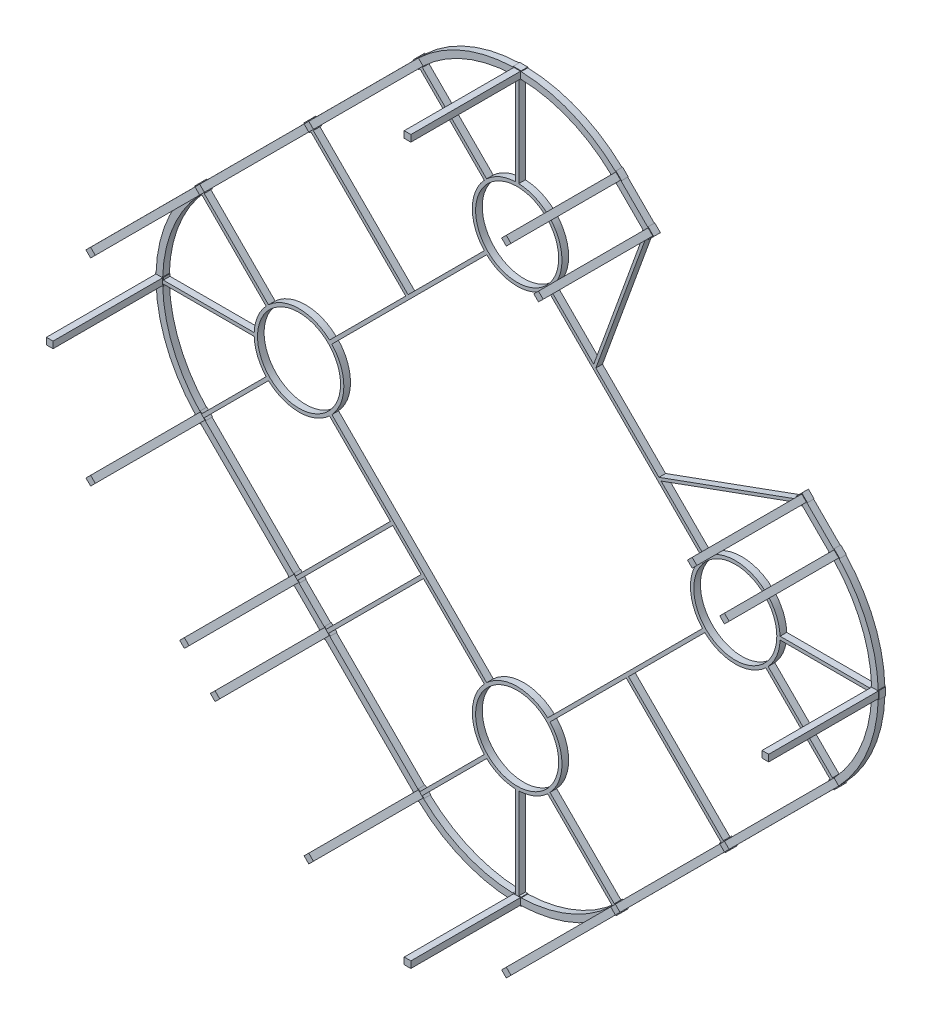
from build123d import *

# Parameters (mm, degrees)
SKETCH1_W           = 2
SKETCH1_H           = 2
SKETCH1_R           = 12.5
BOSS_EXTRUDE1_DEPTH = 2
BOSS_EXTRUDE2_START = 33
SKETCH1_4_W         = 2
SKETCH1_4_H         = 2
BOSS_EXTRUDE2_DEPTH = 35


with BuildPart() as part:
    # Sketch1 → Boss-Extrude1 (new body)
    with BuildSketch(Plane.XY):
        with BuildLine():
            Line((-31.435123313, 95.412267808), (-31.294942546, 95.272087041))
            Line((-31.294942546, 95.272087041), (-62.43499077, 64.132038826))
            Line((-62.43499077, 64.132038826), (-62.571728993, 64.268777048))
            ThreePointArc((-62.571728993, 64.268777048), (-63.424888478, 63.424880259), (-64.268785267, 62.571720774))
            Line((-64.268785267, 62.571720774), (-64.132047045, 62.434982551))
            Line((-64.132047045, 62.434982551), (-95.277376251, 31.289653354))
            Line((-95.277376251, 31.289653354), (-95.416507662, 31.428775598))
            ThreePointArc((-95.416507662, 31.428775598), (-96.269639345, 30.584850702), (-97.113508027, 29.731663416))
            Line((-97.113508027, 29.731663416), (-96.962451883, 29.580617225))
            ThreePointArc((-96.962451883, 29.580617225), (-105.455698333, 16.473999941), (-108.715081354, 1.2))
            Line((-108.715081354, 1.2), (-108.925171911, 1.2))
            ThreePointArc((-108.925171911, 1.2), (-108.931721626, 0), (-108.925171911, -1.2))
            Line((-108.925171911, -1.2), (-108.715081354, -1.2))
            ThreePointArc((-108.715081354, -1.2), (-105.454208222, -16.477597845), (-96.95710069, -29.586276386))
            Line((-96.95710069, -29.586276386), (-97.11252837, -29.741704066))
            ThreePointArc((-97.11252837, -29.741704066), (-96.268631581, -30.594863551), (-95.415472097, -31.43876034))
            Line((-95.415472097, -31.43876034), (-95.271870681, -31.295158925))
            Line((-95.271870681, -31.295158925), (-68.75163623, -57.815393377))
            Line((-68.75163623, -57.815393377), (-68.883691414, -57.947448561))
            ThreePointArc((-68.883691414, -57.947448561), (-68.039794625, -58.800608046), (-67.18663514, -59.644504836))
            Line((-67.18663514, -59.644504836), (-67.054579955, -59.512449651))
            Line((-67.054579955, -59.512449651), (-59.512441432, -67.054588174))
            Line((-59.512441432, -67.054588174), (-59.644496617, -67.186643359))
            ThreePointArc((-59.644496617, -67.186643359), (-58.800599827, -68.039802844), (-57.947440342, -68.883699633))
            Line((-57.947440342, -68.883699633), (-57.815385158, -68.751644449))
            Line((-57.815385158, -68.751644449), (-31.289437098, -95.277592509))
            Line((-31.289437098, -95.277592509), (-31.431979886, -95.420144689))
            ThreePointArc((-31.431979886, -95.420144689), (-30.58805499, -96.273276372), (-29.734867704, -97.117145054))
            Line((-29.734867704, -97.117145054), (-29.580394899, -96.962662071))
            ThreePointArc((-29.580394899, -96.962662071), (-16.473858603, -105.455756861), (-1.2, -108.715081354))
            Line((-1.2, -108.715081354), (-1.2, -108.925171911))
            ThreePointArc((-1.2, -108.925171911), (0, -108.931721626), (1.2, -108.925171911))
            Line((1.2, -108.925171911), (1.2, -108.715081354))
            ThreePointArc((1.2, -108.715081354), (16.475362295, -105.455134144), (29.582760167, -96.960425786))
            Line((29.582760167, -96.960425786), (29.738499779, -97.116165398))
            ThreePointArc((29.738499779, -97.116165398), (30.591659251, -96.272268621), (31.435556028, -95.419109149))
            Line((31.435556028, -95.419109149), (31.291738242, -95.275291363))
            Line((31.291738242, -95.275291363), (62.434990775, -64.13203883))
            Line((62.434990775, -64.13203883), (62.571728993, -64.268777048))
            ThreePointArc((62.571728993, -64.268777048), (63.424888478, -63.424880259), (64.268785267, -62.571720774))
            Line((64.268785267, -62.571720774), (64.13204705, -62.434982556))
            Line((64.13204705, -62.434982556), (95.274171844, -31.292857762))
            Line((95.274171844, -31.292857762), (95.416940402, -31.435616913))
            ThreePointArc((95.416940402, -31.435616913), (96.270072085, -30.591692018), (97.113940767, -29.738504732))
            Line((97.113940767, -29.738504732), (96.959337229, -29.58391138))
            ThreePointArc((96.959337229, -29.58391138), (105.454831021, -16.476094196), (108.715081354, -1.2))
            Line((108.715081354, -1.2), (108.925171911, -1.2))
            ThreePointArc((108.925171911, -1.2), (108.931721626, 0), (108.925171911, 1.2))
            Line((108.925171911, 1.2), (108.715081354, 1.2))
            ThreePointArc((108.715081354, 1.2), (105.455192708, 16.475220886), (96.960636099, 29.58253774))
            Line((96.960636099, 29.58253774), (97.11296111, 29.734862751))
            ThreePointArc((97.11296111, 29.734862751), (96.269064321, 30.588022236), (95.415904836, 31.431919026))
            Line((95.415904836, 31.431919026), (95.275507708, 31.291521898))
            Line((95.275507708, 31.291521898), (87.267374473, 39.299655132))
            Line((87.267374473, 39.299655132), (87.391886748, 39.424175611))
            ThreePointArc((87.391886748, 39.424175611), (86.547961853, 40.277307294), (85.694774566, 41.121175976))
            Line((85.694774566, 41.121175976), (83.997730649, 39.424020239))
            Line((83.997730649, 39.424020239), (84.523348399, 38.90501768))
            Line((84.523348399, 38.90501768), (42.688694475, 23.692180335))
            Line((42.688694475, 23.692180335), (23.692180335, 42.688694476))
            Line((23.692180335, 42.688694476), (38.90501768, 84.523348399))
            ThreePointArc((38.90501768, 84.523348399), (39.165408576, 84.259818217), (39.42489, 83.995392488))
            Line((39.42489, 83.995392488), (41.121989828, 85.692492316))
            ThreePointArc((41.121989828, 85.692492316), (40.278093039, 86.545651802), (39.424933554, 87.389548591))
            Line((39.424933554, 87.389548591), (39.301207283, 87.26582232))
            Line((39.301207283, 87.26582232), (31.29307402, 95.273955586))
            Line((31.29307402, 95.273955586), (31.432412626, 95.413303374))
            ThreePointArc((31.432412626, 95.413303374), (30.588487731, 96.266435057), (29.735300444, 97.110303739))
            Line((29.735300444, 97.110303739), (29.584133682, 96.959127017))
            ThreePointArc((29.584133682, 96.959127017), (16.47623553, 105.454772485), (1.2, 108.715081354))
            Line((1.2, 108.715081354), (1.2, 108.925171911))
            ThreePointArc((1.2, 108.925171911), (0, 108.931721626), (-1.2, 108.925171911))
            Line((-1.2, 108.925171911), (-1.2, 108.715081354))
            ThreePointArc((-1.2, 108.715081354), (-16.477456439, 105.454266794), (-29.586053982, 96.957311026))
            Line((-29.586053982, 96.957311026), (-29.738067039, 97.109324083))
            ThreePointArc((-29.738067039, 97.109324083), (-30.591226524, 96.265427293), (-31.435123313, 95.412267808))
        make_face()
        Polygon((-57.948849643, -65.773839097), (-56.534636081, -67.188052659), (-57.948849644, -68.602266222), (-59.363063205, -67.18805266), align=None, mode=Mode.SUBTRACT)
        Polygon((-68.602258003, -57.948857862), (-67.18804444, -56.5346443), (-65.773830878, -57.948857862), (-67.188044441, -59.363071424), align=None, mode=Mode.SUBTRACT)
        with BuildLine():
            Line((-1, -108.720192419), (-1, -106.727164964))
            Line((-1, -106.727164964), (1, -106.727164964))
            Line((1, -106.727164964), (1, -108.720192419))
            ThreePointArc((1, -108.720192419), (0, -108.731806219), (-1, -108.720192419))
        make_face(mode=Mode.SUBTRACT)
        with BuildLine():
            ThreePointArc((-0.5, -106.530643766), (-0.850004503, -106.528446659), (-1.2, -106.525110317))
            Line((-1.2, -106.525110317), (-1.2, -106.71426632))
            ThreePointArc((-1.2, -106.71426632), (-15.708522052, -103.607985233), (-28.165645199, -95.547819152))
            Line((-28.165645199, -95.547819152), (-28.037823786, -95.419989317))
            ThreePointArc((-28.037823786, -95.419989317), (-28.290532968, -95.17205965), (-28.542424536, -94.923299346))
            Line((-28.542424536, -94.923299346), (-9.185838624, -75.566713434))
            ThreePointArc((-9.185838624, -75.566713434), (-5.166226337, -78.146141718), (-0.5, -79.164505592))
            Line((-0.5, -79.164505592), (-0.5, -106.530643766))
        make_face(mode=Mode.SUBTRACT)
        with BuildLine():
            Line((-9.892945405, -74.859606653), (-29.249501876, -94.216163124))
            ThreePointArc((-29.249501876, -94.216163124), (-29.49261564, -93.96996653), (-29.734935968, -93.722988952))
            Line((-29.734935968, -93.722988952), (-29.875270126, -93.863332356))
            Line((-29.875270126, -93.863332356), (-56.401171595, -67.337430886))
            Line((-56.401171595, -67.337430886), (-56.250340514, -67.186599805))
            ThreePointArc((-56.250340514, -67.186599805), (-56.500190067, -66.94146865), (-56.749240385, -66.695525526))
            Line((-56.749240385, -66.695525526), (-28.217294835, -38.163579976))
            Line((-28.217294835, -38.163579976), (-9.892945405, -56.487929406))
            ThreePointArc((-9.892945405, -56.487929406), (-13.5, -65.673768029), (-9.892945405, -74.859606653))
        make_face(mode=Mode.SUBTRACT)
        Polygon((-96.824253644, -29.736272052), (-95.410040081, -28.32205849), (-93.99588073, -29.736326262), (-95.410094292, -31.150539824), align=None, mode=Mode.SUBTRACT)
        with BuildLine():
            Line((-93.857657118, -29.880945363), (-93.718372267, -29.741660512))
            ThreePointArc((-93.718372267, -29.741660512), (-93.968265881, -29.496485989), (-94.217359977, -29.250499209))
            Line((-94.217359977, -29.250499209), (-74.859710109, -9.892849343))
            ThreePointArc((-74.859710109, -9.892849343), (-65.673838618, -13.5), (-56.487929406, -9.892945405))
            Line((-56.487929406, -9.892945405), (-38.163579976, -28.217294835))
            Line((-38.163579976, -28.217294835), (-66.695525488, -56.749240347))
            ThreePointArc((-66.695525488, -56.749240347), (-66.941464508, -56.500194144), (-67.186591586, -56.250348733))
            Line((-67.186591586, -56.250348733), (-67.337422681, -56.401179828))
            Line((-67.337422681, -56.401179828), (-93.857657118, -29.880945363))
        make_face(mode=Mode.SUBTRACT)
        with BuildLine():
            Line((-106.71426632, -1.2), (-106.525110317, -1.2))
            ThreePointArc((-106.525110317, -1.2), (-106.528446659, -0.850004502), (-106.530643766, -0.499999998))
            Line((-106.530643766, -0.499999998), (-79.164505593, -0.5))
            ThreePointArc((-79.164505593, -0.5), (-78.146141718, -5.166226337), (-75.566713434, -9.185838624))
            Line((-75.566713434, -9.185838624), (-94.924581431, -28.543274818))
            ThreePointArc((-94.924581431, -28.543274818), (-95.170410598, -28.294338776), (-95.415428542, -28.044604238))
            Line((-95.415428542, -28.044604238), (-95.542310811, -28.171486507))
            ThreePointArc((-95.542310811, -28.171486507), (-103.606449157, -15.71223098), (-106.71426632, -1.2))
        make_face(mode=Mode.SUBTRACT)
        with Locations((-107.727164964, 0)):
            Rectangle(SKETCH1_W, SKETCH1_H, mode=Mode.SUBTRACT)
        with BuildLine():
            Line((-37.456473194, -28.924401616), (-28.924401616, -37.456473194))
            Line((-28.924401616, -37.456473194), (-57.456347052, -65.98841863))
            ThreePointArc((-57.456347052, -65.98841863), (-57.702277865, -65.739380657), (-57.947396788, -65.48954353))
            Line((-57.947396788, -65.48954353), (-58.09822787, -65.640374612))
            Line((-58.09822787, -65.640374612), (-65.640366392, -58.098236089))
            Line((-65.640366392, -58.098236089), (-65.489535311, -57.947405007))
            ThreePointArc((-65.489535311, -57.947405007), (-65.73937658, -57.702282007), (-65.988418669, -57.45634709))
            Line((-65.988418669, -57.45634709), (-37.456473194, -28.924401616))
        make_face(mode=Mode.SUBTRACT)
        with BuildLine():
            Line((1.2, -106.71426632), (1.2, -106.525110317))
            ThreePointArc((1.2, -106.525110317), (0.850004503, -106.528446659), (0.5, -106.530643766))
            Line((0.5, -106.530643766), (0.5, -79.164505592))
            ThreePointArc((0.5, -79.164505592), (5.166226337, -78.146141718), (9.185838623, -75.566713434))
            Line((9.185838623, -75.566713434), (28.543507024, -94.924813642))
            ThreePointArc((28.543507024, -94.924813642), (28.292858284, -95.172350836), (28.04139995, -95.41906557))
            Line((28.04139995, -95.41906557), (28.16796563, -95.545631249))
            ThreePointArc((28.16796563, -95.545631249), (15.709995342, -103.607375112), (1.2, -106.71426632))
        make_face(mode=Mode.SUBTRACT)
        Polygon((28.318854202, -95.413677109), (29.733122848, -93.999518631), (31.14733641, -95.413732193), (29.733067765, -96.827890671), align=None, mode=Mode.SUBTRACT)
        with Locations((0, -65.673768029)):
            Circle(SKETCH1_R, mode=Mode.SUBTRACT)
        with BuildLine():
            ThreePointArc((61.373512521, -62.080619303), (61.124470433, -62.326554219), (60.874629164, -62.57167722))
            Line((60.874629164, -62.57167722), (61.020777213, -62.717825268))
            Line((61.020777213, -62.717825268), (29.87752468, -93.861077801))
            Line((29.87752468, -93.861077801), (29.738456199, -93.72200932))
            ThreePointArc((29.738456199, -93.72200932), (29.494978432, -93.970179101), (29.250699576, -94.217560393))
            Line((29.250699576, -94.217560393), (9.892849342, -74.859710109))
            ThreePointArc((9.892849342, -74.859710109), (13.5, -65.673838618), (9.892945405, -56.487929406))
            Line((9.892945405, -56.487929406), (32.836884015, -33.543990796))
            Line((32.836884015, -33.543990796), (61.373512521, -62.080619303))
        make_face(mode=Mode.SUBTRACT)
        Polygon((61.162198569, -62.576403912), (62.576412131, -61.16219035), (63.987351856, -62.573130075), (62.573138294, -63.987343637), align=None, mode=Mode.SUBTRACT)
        with BuildLine():
            Line((62.717833487, -61.020768994), (62.571685439, -60.874620945))
            ThreePointArc((62.571685439, -60.874620945), (62.326558361, -61.124466356), (62.080619341, -61.37351256))
            Line((62.080619341, -61.37351256), (33.543990796, -32.836884015))
            Line((33.543990796, -32.836884015), (56.487929406, -9.892945405))
            ThreePointArc((56.487929406, -9.892945405), (65.673768029, -13.5), (74.859606653, -9.892945405))
            Line((74.859606653, -9.892945405), (94.216395465, -29.249734217))
            ThreePointArc((94.216395465, -29.249734217), (93.968486044, -29.494555882), (93.719784664, -29.738572996))
            Line((93.719784664, -29.738572996), (93.859911691, -29.87869079))
            Line((93.859911691, -29.87869079), (62.717833487, -61.020768994))
        make_face(mode=Mode.SUBTRACT)
        Polygon((95.411553103, -31.147396575), (93.997293824, -29.733230477), (95.411405709, -28.318915243), (96.825665861, -29.733082215), align=None, mode=Mode.SUBTRACT)
        with BuildLine():
            Line((95.544498976, -28.169166346), (95.416785029, -28.041460814))
            ThreePointArc((95.416785029, -28.041460814), (95.170552124, -28.29244617), (94.923499876, -28.542625065))
            Line((94.923499876, -28.542625065), (75.566713434, -9.185838623))
            ThreePointArc((75.566713434, -9.185838623), (78.146141718, -5.166226337), (79.164505592, -0.5))
            Line((79.164505592, -0.5), (106.530643766, -0.5))
            ThreePointArc((106.530643766, -0.5), (106.528446659, -0.850004503), (106.525110317, -1.2))
            Line((106.525110317, -1.2), (106.71426632, -1.2))
            ThreePointArc((106.71426632, -1.2), (103.607059362, -15.710757734), (95.544498976, -28.169166346))
        make_face(mode=Mode.SUBTRACT)
        with BuildLine():
            ThreePointArc((-106.530643766, 0.500000002), (-106.528446659, 0.850004504), (-106.525110317, 1.2))
            Line((-106.525110317, 1.2), (-106.71426632, 1.2))
            ThreePointArc((-106.71426632, 1.2), (-103.607926703, 15.708663396), (-95.547609259, 28.165867821))
            Line((-95.547609259, 28.165867821), (-95.416352289, 28.034619499))
            ThreePointArc((-95.416352289, 28.034619499), (-95.168529951, 28.287219642), (-94.919877692, 28.53900288))
            Line((-94.919877692, 28.53900288), (-75.566713434, 9.185838624))
            ThreePointArc((-75.566713434, 9.185838624), (-78.146141718, 5.166226337), (-79.164505593, 0.5))
            Line((-79.164505593, 0.5), (-106.530643766, 0.500000002))
        make_face(mode=Mode.SUBTRACT)
        with Locations((-65.673768029, 0)):
            Circle(SKETCH1_R, mode=Mode.SUBTRACT)
        with BuildLine():
            Line((-93.996861084, 29.726389161), (-95.410972969, 28.312073928))
            Line((-95.410972969, 28.312073928), (-96.824670308, 29.725678123))
            ThreePointArc((-96.824670308, 29.725678123), (-96.474644043, 30.088215127), (-96.120398817, 30.446630788))
            Line((-96.120398817, 30.446630788), (-95.411120363, 31.140555259))
            Line((-95.411120363, 31.140555259), (-93.996861084, 29.726389161))
        make_face(mode=Mode.SUBTRACT)
        with BuildLine():
            Line((-62.717833482, 61.020768989), (-62.571685439, 60.874620945))
            ThreePointArc((-62.571685439, 60.874620945), (-62.326558361, 61.124466356), (-62.080619341, 61.37351256))
            Line((-62.080619341, 61.37351256), (-33.543990796, 32.836884015))
            Line((-33.543990796, 32.836884015), (-56.487929406, 9.892945405))
            ThreePointArc((-56.487929406, 9.892945405), (-65.673768029, 13.5), (-74.859606653, 9.892945405))
            Line((-74.859606653, 9.892945405), (-94.212743482, 29.246082232))
            ThreePointArc((-94.212743482, 29.246082232), (-93.966438542, 29.489304024), (-93.719351925, 29.73173168))
            Line((-93.719351925, 29.73173168), (-93.863116099, 29.875486382))
            Line((-93.863116099, 29.875486382), (-62.717833482, 61.020768989))
        make_face(mode=Mode.SUBTRACT)
        with BuildLine():
            Line((-55.780822625, 9.185838624), (-9.185838624, 55.780822625))
            ThreePointArc((-9.185838624, 55.780822625), (5.4698e-05, 52.173768029), (9.18591879, 55.780897062))
            Line((9.18591879, 55.780897062), (55.780844249, 9.185861913))
            ThreePointArc((55.780844249, 9.185861913), (52.173768029, 1.589e-05), (55.780822624, -9.185838624))
            Line((55.780822624, -9.185838624), (9.185838623, -55.780822625))
            ThreePointArc((9.185838623, -55.780822625), (-5.4698e-05, -52.173768029), (-9.18591879, -55.780897062))
            Line((-9.18591879, -55.780897062), (-55.780844249, -9.185861913))
            ThreePointArc((-55.780844249, -9.185861913), (-52.173768029, -1.589e-05), (-55.780822625, 9.185838624))
        make_face(mode=Mode.SUBTRACT)
        Polygon((-62.57313829, 63.987343631), (-61.162198565, 62.576403906), (-62.576412127, 61.162190344), (-63.987351852, 62.573130069), align=None, mode=Mode.SUBTRACT)
        with BuildLine():
            ThreePointArc((-61.373512521, 62.080619303), (-61.124470433, 62.326554219), (-60.874629164, 62.57167722))
            Line((-60.874629164, 62.57167722), (-61.020777208, 62.717825263))
            Line((-61.020777208, 62.717825263), (-29.880728983, 93.857873478))
            Line((-29.880728983, 93.857873478), (-29.738023485, 93.71516798))
            ThreePointArc((-29.738023485, 93.71516798), (-29.492956289, 93.964952554), (-29.247077546, 94.213938312))
            Line((-29.247077546, 94.213938312), (-9.892849343, 74.859710109))
            ThreePointArc((-9.892849343, 74.859710109), (-13.5, 65.673838618), (-9.892945405, 56.487929406))
            Line((-9.892945405, 56.487929406), (-32.836884015, 33.543990796))
            Line((-32.836884015, 33.543990796), (-61.373512521, 62.080619303))
        make_face(mode=Mode.SUBTRACT)
        Polygon((-29.732635025, 96.821049356), (-28.318421462, 95.406835794), (-29.732690108, 93.992677315), (-31.146902797, 95.406890004), align=None, mode=Mode.SUBTRACT)
        with BuildLine():
            Line((-1.2, 106.71426632), (-1.2, 106.525110317))
            ThreePointArc((-1.2, 106.525110317), (-0.850004503, 106.528446659), (-0.5, 106.530643766))
            Line((-0.5, 106.530643766), (-0.5, 79.164505593))
            ThreePointArc((-0.5, 79.164505593), (-5.166226337, 78.146141718), (-9.185838624, 75.566713434))
            Line((-9.185838624, 75.566713434), (-28.539855206, 94.921161742))
            ThreePointArc((-28.539855206, 94.921161742), (-28.290810806, 95.167098964), (-28.04096721, 95.412224254))
            Line((-28.04096721, 95.412224254), (-28.17126381, 95.542520854))
            ThreePointArc((-28.17126381, 95.542520854), (-15.712089569, 103.606507731), (-1.2, 106.71426632))
        make_face(mode=Mode.SUBTRACT)
        with BuildLine():
            Line((1, 106.727164964), (-1, 106.727164964))
            Line((-1, 106.727164964), (-1, 108.720192419))
            ThreePointArc((-1, 108.720192419), (0, 108.731806219), (1, 108.720192419))
            Line((1, 108.720192419), (1, 106.727164964))
        make_face(mode=Mode.SUBTRACT)
        with Locations((65.673768029, 0)):
            Circle(SKETCH1_R, mode=Mode.SUBTRACT)
        with BuildLine():
            Line((93.863082275, 29.879096465), (93.718805007, 29.734819197))
            ThreePointArc((93.718805007, 29.734819197), (93.966865748, 29.491448755), (94.214138694, 29.247277929))
            Line((94.214138694, 29.247277929), (74.859710108, 9.892849343))
            ThreePointArc((74.859710108, 9.892849343), (65.673838618, 13.5), (56.487929406, 9.892945405))
            Line((56.487929406, 9.892945405), (43.3372758, 23.043599011))
            Line((43.3372758, 23.043599011), (85.17193376, 38.256437823))
            Line((85.17193376, 38.256437823), (85.694842831, 37.727019874))
            Line((85.694842831, 37.727019874), (85.85473176, 37.886919338))
            Line((85.85473176, 37.886919338), (93.863082275, 29.879096465))
        make_face(mode=Mode.SUBTRACT)
        with Locations((107.727164964, 0)):
            Rectangle(SKETCH1_W, SKETCH1_H, mode=Mode.SUBTRACT)
        with BuildLine():
            Line((106.71426632, 1.2), (106.525110317, 1.2))
            ThreePointArc((106.525110317, 1.2), (106.528446659, 0.850004503), (106.530643766, 0.5))
            Line((106.530643766, 0.5), (79.164505592, 0.5))
            ThreePointArc((79.164505592, 0.5), (78.146141718, 5.166226337), (75.566713434, 9.185838624))
            Line((75.566713434, 9.185838624), (94.921393943, 28.540087402))
            ThreePointArc((94.921393943, 28.540087402), (95.169039199, 28.289330311), (95.415861282, 28.037762923))
            Line((95.415861282, 28.037762923), (95.545841266, 28.167742907))
            ThreePointArc((95.545841266, 28.167742907), (103.607433678, 15.709853927), (106.71426632, 1.2))
        make_face(mode=Mode.SUBTRACT)
        Polygon((95.410472821, 28.315217175), (93.996314343, 29.72948582), (95.410527032, 31.143698509), (96.82468551, 29.729429864), align=None, mode=Mode.SUBTRACT)
        with Locations((0, 65.673768029)):
            Circle(SKETCH1_R, mode=Mode.SUBTRACT)
        with BuildLine():
            ThreePointArc((29.246314564, 94.212975812), (29.491244264, 93.964958053), (29.735368708, 93.716147637))
            Line((29.735368708, 93.716147637), (29.878907047, 93.859695434))
            Line((29.878907047, 93.859695434), (37.886993721, 85.851608758))
            Line((37.886993721, 85.851608758), (37.727833725, 85.692448762))
            ThreePointArc((37.727833725, 85.692448762), (37.992584654, 85.432647117), (38.256437823, 85.17193376))
            Line((38.256437823, 85.17193376), (23.04359901, 43.3372758))
            Line((23.04359901, 43.3372758), (9.892945405, 56.487929406))
            ThreePointArc((9.892945405, 56.487929406), (13.5, 65.673768029), (9.892945405, 74.859606653))
            Line((9.892945405, 74.859606653), (29.246314564, 94.212975812))
        make_face(mode=Mode.SUBTRACT)
        with BuildLine():
            Line((28.169388943, 95.544289058), (28.038256526, 95.413148002))
            ThreePointArc((28.038256526, 95.413148002), (28.289132843, 95.167022422), (28.539203401, 94.920078211))
            Line((28.539203401, 94.920078211), (9.185838624, 75.566713434))
            ThreePointArc((9.185838624, 75.566713434), (5.166226337, 78.146141718), (0.5, 79.164505593))
            Line((0.5, 79.164505593), (0.5, 106.530643766))
            ThreePointArc((0.5, 106.530643766), (0.850004503, 106.528446659), (1.2, 106.525110317))
            Line((1.2, 106.525110317), (1.2, 106.71426632))
            ThreePointArc((1.2, 106.71426632), (15.710899074, 103.607000824), (28.169388943, 95.544289058))
        make_face(mode=Mode.SUBTRACT)
        Polygon((40.840556417, 85.693901618), (39.426342854, 84.279688055), (38.012129292, 85.693901617), (39.426342855, 87.10811518), align=None, mode=Mode.SUBTRACT)
        Polygon((29.730026189, 93.993656796), (28.315710956, 95.407768682), (29.729877927, 96.822028834), (31.144192287, 95.407916075), align=None, mode=Mode.SUBTRACT)
    extrude(amount=-BOSS_EXTRUDE1_DEPTH)

    # Sketch1<4> → Boss-Extrude2 (add)
    with BuildSketch(Plane.XY.offset(BOSS_EXTRUDE2_START)):
        with Locations((-107.727164964, 0)):
            Rectangle(SKETCH1_4_W, SKETCH1_4_H)
        with BuildLine():
            Line((-96.824670308, 29.725678123), (-95.410972969, 28.312073928))
            Line((-95.410972969, 28.312073928), (-93.996861084, 29.726389161))
            Line((-93.996861084, 29.726389161), (-95.411120363, 31.140555259))
            Line((-95.411120363, 31.140555259), (-96.120398817, 30.446630788))
            ThreePointArc((-96.120398817, 30.446630788), (-96.474644043, 30.088215127), (-96.824670308, 29.725678123))
        make_face()
        Polygon((-62.576412127, 61.162190344), (-61.162198565, 62.576403906), (-62.57313829, 63.987343631), (-63.987351852, 62.573130069), align=None)
        Polygon((-29.732690108, 93.992677315), (-28.318421462, 95.406835794), (-29.732635025, 96.821049356), (-31.146902797, 95.406890004), align=None)
        with BuildLine():
            Line((-1, 108.720192419), (-1, 106.727164964))
            Line((-1, 106.727164964), (1, 106.727164964))
            Line((1, 106.727164964), (1, 108.720192419))
            ThreePointArc((1, 108.720192419), (0, 108.731806219), (-1, 108.720192419))
        make_face()
        Polygon((29.729877927, 96.822028834), (28.315710956, 95.407768682), (29.730026189, 93.993656796), (31.144192287, 95.407916075), align=None)
        Polygon((38.012129292, 85.693901617), (39.426342854, 84.279688055), (40.840556417, 85.693901618), (39.426342855, 87.10811518), align=None)
        Polygon((85.696193139, 40.839742612), (84.282026168, 39.42548246), (85.69628632, 38.011315489), (87.110453291, 39.425575641), align=None)
        Polygon((95.410527032, 31.143698509), (93.996314343, 29.72948582), (95.410472821, 28.315217175), (96.82468551, 29.729429864), align=None)
        with Locations((107.727164964, 0)):
            Rectangle(SKETCH1_4_W, SKETCH1_4_H)
        Polygon((95.411405709, -28.318915243), (93.997293824, -29.733230477), (95.411553103, -31.147396575), (96.825665861, -29.733082215), align=None)
        Polygon((63.987351856, -62.573130075), (62.576412131, -61.16219035), (61.162198569, -62.576403912), (62.573138294, -63.987343637), align=None)
        Polygon((31.14733641, -95.413732193), (29.733122848, -93.999518631), (28.318854202, -95.413677109), (29.733067765, -96.827890671), align=None)
        with BuildLine():
            Line((1, -106.727164964), (-1, -106.727164964))
            Line((-1, -106.727164964), (-1, -108.720192419))
            ThreePointArc((-1, -108.720192419), (0, -108.731806219), (1, -108.720192419))
            Line((1, -108.720192419), (1, -106.727164964))
        make_face()
        Polygon((-28.315278216, -95.414609997), (-29.729593449, -94.000498112), (-31.143759547, -95.41475739), (-29.729444314, -96.828869276), align=None)
        Polygon((-57.948849644, -68.602266222), (-56.534636081, -67.188052659), (-57.948849643, -65.773839097), (-59.363063205, -67.18805266), align=None)
        Polygon((-65.773830878, -57.948857862), (-67.18804444, -56.5346443), (-68.602258003, -57.948857862), (-67.188044441, -59.363071424), align=None)
        Polygon((-93.99588073, -29.736326262), (-95.410040081, -28.32205849), (-96.824253644, -29.736272052), (-95.410094292, -31.150539824), align=None)
    extrude(amount=-BOSS_EXTRUDE2_DEPTH)


solid = part.part
